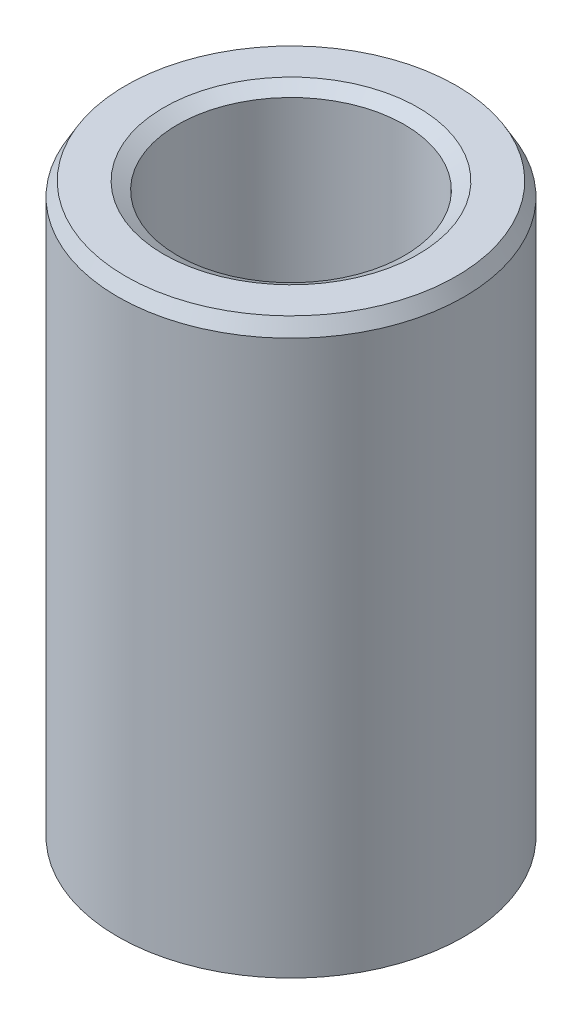
from build123d import *
from OCP.BRepFilletAPI import BRepFilletAPI_MakeChamfer

# Parameters (mm, degrees)
SKETCH1_R           = 50
BOSS_EXTRUDE1_DEPTH = 166.203326575
SKETCH2_R           = 32.74201828
CUT_EXTRUDE1_DEPTH  = 181.619893048
CHAMFER1_SIZE       = 3.973594954
CHAMFER1_SIZE2      = 2.294156117


with BuildPart() as part:
    # Sketch1 → Boss-Extrude1 (new body)
    with BuildSketch(Plane(origin=(0, 0, 0), x_dir=(1, 0, 0), z_dir=(0, 1, 0))):
        Circle(SKETCH1_R)
    extrude(amount=BOSS_EXTRUDE1_DEPTH)

    # Sketch2 → Cut-Extrude1 (cut, through all)
    with BuildSketch(Plane(origin=(0, 0, 0), x_dir=(1, 0, 0), z_dir=(0, 1, 0))):
        Circle(SKETCH2_R)
    extrude(amount=CUT_EXTRUDE1_DEPTH, mode=Mode.SUBTRACT)

    # Chamfer1: one chamfer whose edges measure the first distance from different faces: ONE call of the kernel's chamfer builder (chamfer() names one face for all edges)
    chamfer1_edges_1 = [part.edges().sort_by_distance(p)[0] for p in [
        (-32.74201828, 166.203326575, 0),
    ]]
    chamfer1_side_1 = [part.faces().sort_by_distance(p)[0] for p in [
        (-48.585786438, 166.203326575, 0),
    ]]
    chamfer1_edges_2 = [part.edges().sort_by_distance(p)[0] for p in [
        (-32.74201828, 0, 0),
    ]]
    chamfer1_side_2 = [part.faces().sort_by_distance(p)[0] for p in [
        (-32.74201828, 83.101663287, 0),
    ]]
    chamfer1_edges_3 = [part.edges().sort_by_distance(p)[0] for p in [
        (-50, 0, 0),
    ]]
    chamfer1_side_3 = [part.faces().sort_by_distance(p)[0] for p in [
        (-48.585786438, 0, 0),
    ]]
    chamfer1_edges_4 = [part.edges().sort_by_distance(p)[0] for p in [
        (-50, 166.203326575, 0),
    ]]
    chamfer1_side_4 = [part.faces().sort_by_distance(p)[0] for p in [
        (-50, 83.101663287, 0),
    ]]
    chamfer1 = BRepFilletAPI_MakeChamfer(part.part.solid().wrapped)
    for e in chamfer1_edges_1:
        chamfer1.Add(CHAMFER1_SIZE, CHAMFER1_SIZE2, e.wrapped, chamfer1_side_1[0].wrapped)  # the first distance lies on this face
    for e in chamfer1_edges_2:
        chamfer1.Add(CHAMFER1_SIZE, CHAMFER1_SIZE2, e.wrapped, chamfer1_side_2[0].wrapped)  # the first distance lies on this face
    for e in chamfer1_edges_3:
        chamfer1.Add(CHAMFER1_SIZE, CHAMFER1_SIZE2, e.wrapped, chamfer1_side_3[0].wrapped)  # the first distance lies on this face
    for e in chamfer1_edges_4:
        chamfer1.Add(CHAMFER1_SIZE, CHAMFER1_SIZE2, e.wrapped, chamfer1_side_4[0].wrapped)  # the first distance lies on this face
    add(Compound.cast(chamfer1.Shape()), mode=Mode.REPLACE)


solid = part.part
